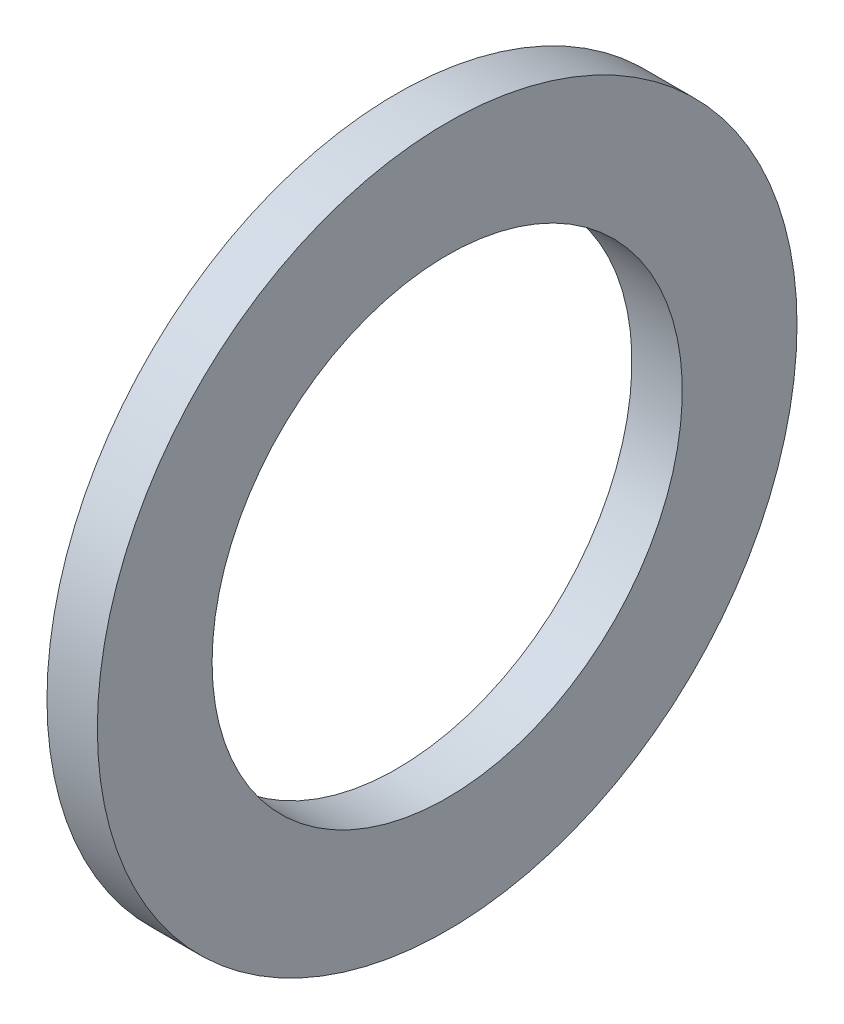
from build123d import *

# Parameters (mm, degrees)
SKETCH1_W = 18
SKETCH1_H = 41


with BuildPart() as part:
    # Sketch1 → Base-Revolve (revolve)
    with BuildSketch(Plane.XY):
        with Locations((-9, 104.5)):
            Rectangle(SKETCH1_W, SKETCH1_H)
    revolve(axis=Axis((-34.925, 0, 0), (1, 0, 0)))


solid = part.part
